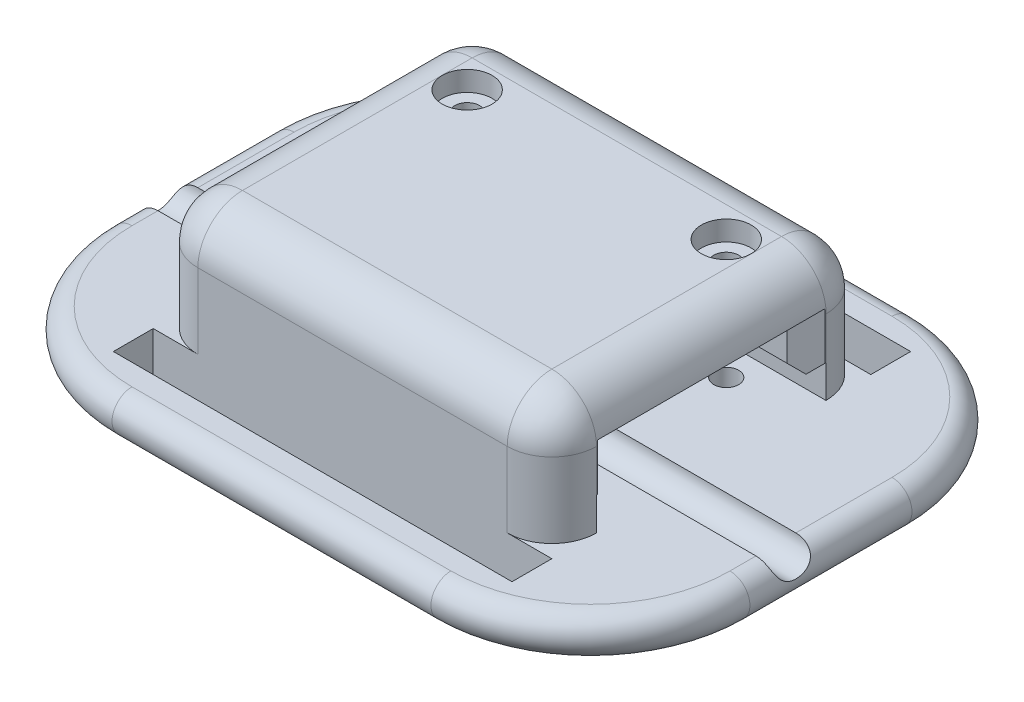
from build123d import *

# Parameters (mm, degrees)
SKETCH1_W               = 31.75
SKETCH1_H               = 25.4
BOSS_EXTRUDE1_DEPTH     = 12.7
SKETCH2_W               = 18.25625
SKETCH2_H               = 6.35
CUT_EXTRUDE3_DEPTH      = 39.058949894
SKETCH4_W               = 1.5875
SKETCH4_H               = 4.7625
BOSS_EXTRUDE2_DEPTH     = 31.75
CUT_EXTRUDE5_DEPTH      = 31.590858593
CUT_EXTRUDE5_DEPTH_BACK = 31.590858593
SKETCH5_R               = 0.9921875
CUT_EXTRUDE6_DEPTH      = 1.5875
SKETCH7_R               = 1.984375
CUT_EXTRUDE7_DEPTH      = 1.5875
SKETCH8_W               = 50.8
SKETCH8_H               = 38.305926372
SKETCH8_W_2             = 31.75
SKETCH8_H_2             = 25.4
BOSS_EXTRUDE3_DEPTH     = 3.175
SKETCH10_W              = 31.75
SKETCH10_H              = 3.175
CUT_EXTRUDE8_DEPTH      = 42.677098196
FILLET6_R               = 12.7
CHAMFER1_SIZE           = 1.016
CHAMFER2_SIZE           = 1.524
FILLET7_R               = 3.556
FILLET10_R              = 1.5875
SKETCH13_R              = 1.5875
CUT_EXTRUDE9_DEPTH      = 74.216005252


# Some blends are built 0.0001 mm under size
with BuildPart() as part:
    # Sketch1 → Boss-Extrude1 (new body)
    with BuildSketch(Plane(origin=(0, 0, 0), x_dir=(1, 0, 0), z_dir=(0, 1, 0))):
        with Locations((7.914574134, 4.007219009)):
            Rectangle(SKETCH1_W, SKETCH1_H)
    extrude(amount=BOSS_EXTRUDE1_DEPTH)

    # Sketch2 → Cut-Extrude3 (cut, through all)
    with BuildSketch(Plane(origin=(23.789574134, 0, 0), x_dir=(0, 0, -1), z_dir=(1, 0, 0))):
        with Locations((4.007219009, 6.35)):
            Rectangle(SKETCH2_W, SKETCH2_H)
    extrude(amount=-CUT_EXTRUDE3_DEPTH, mode=Mode.SUBTRACT)

    # Sketch4 → Boss-Extrude2 (add, through all)
    with BuildSketch(Plane(origin=(23.789574134, 0, 0), x_dir=(0, 0, -1), z_dir=(1, 0, 0))):
        with Locations((-4.327155991, 7.14375)):
            Rectangle(SKETCH4_W, SKETCH4_H)
        with Locations((12.341594009, 7.14375)):
            Rectangle(SKETCH4_W, SKETCH4_H)
    extrude(amount=-BOSS_EXTRUDE2_DEPTH)

    # Sketch5 → Cut-Extrude5 (cut, two sides: drawn at the far end of the back side and taken through both)
    with BuildSketch(Plane(origin=(0, 3.175, 0), x_dir=(1, 0, 0), z_dir=(0, 1, 0)).offset(-CUT_EXTRUDE5_DEPTH_BACK)):
        with Locations(Location((-2.404175866, 10.754094009, 0), (0, 0, 270))):
            Circle(SKETCH5_R)
        with Locations(Location((18.233324134, 10.754094009, 0), (0, 0, 126.869897646))):
            Circle(SKETCH5_R)
    extrude(amount=CUT_EXTRUDE5_DEPTH + CUT_EXTRUDE5_DEPTH_BACK, mode=Mode.SUBTRACT)

    # Sketch6 → Cut-Extrude6 (cut)
    with BuildSketch(Plane.XZ):
        Polygon((-0.022925866, -10.754094009), (-1.213550866, -8.691871016), (-3.594800866, -8.691871016), (-4.785425866, -10.754094009), (-3.594800866, -12.816317002), (-1.213550866, -12.816317002), align=None)
        Polygon((20.614574134, -10.754094009), (19.423949134, -8.691871016), (17.042699134, -8.691871016), (15.852074134, -10.754094009), (17.042699134, -12.816317002), (19.423949134, -12.816317002), align=None)
    extrude(amount=-CUT_EXTRUDE6_DEPTH, mode=Mode.SUBTRACT)

    # Sketch7 → Cut-Extrude7 (cut)
    with BuildSketch(Plane(origin=(0, 12.7, 0), x_dir=(1, 0, 0), z_dir=(0, 1, 0))):
        with Locations(Location((-2.404175866, 10.754094009, 0), (0, 0, 270))):
            Circle(SKETCH7_R)
        with Locations(Location((18.233324134, 10.754094009, 0), (0, 0, 270))):
            Circle(SKETCH7_R)
    extrude(amount=-CUT_EXTRUDE7_DEPTH, mode=Mode.SUBTRACT)

    # Sketch8 → Boss-Extrude3 (add)
    with BuildSketch(Plane.XZ):
        with Locations((7.914574134, -4.007219009)):
            Rectangle(SKETCH8_W, SKETCH8_H)
        with Locations((7.914574134, -4.007219009)):
            Rectangle(SKETCH8_W_2, SKETCH8_H_2, mode=Mode.SUBTRACT)
    extrude(amount=-BOSS_EXTRUDE3_DEPTH)

    # Sketch10 → Cut-Extrude8 (cut, through all)
    with BuildSketch(Plane(origin=(0, 3.175, 0), x_dir=(1, 0, 0), z_dir=(0, 1, 0))):
        with Locations((7.914574134, 18.294719009)):
            Rectangle(SKETCH10_W, SKETCH10_H)
        with Locations((7.914574134, -10.280280991)):
            Rectangle(SKETCH10_W, SKETCH10_H)
    extrude(amount=-CUT_EXTRUDE8_DEPTH, mode=Mode.SUBTRACT)

    # Fillet6
    fillet6_edges = [part.edges().sort_by_distance(p)[0] for p in [
        (-17.485425866, 1.5875, 15.145744177),
        (33.314574134, 1.5875, 15.145744177),
        (33.314574134, 1.5875, -23.160182195),
        (-17.485425866, 1.5875, -23.160182195),
    ]]
    fillet(fillet6_edges, radius=FILLET6_R)

    # Chamfer1
    # the kernel refuses this chamfer: 1.016 mm, written as the material it takes off along each edge
    with BuildSketch(Plane(origin=(-7.960425866, 4.7625, 0.920576075), x_dir=(-0.027495876610586435, 0.9996219169112968, 0), z_dir=(0, 0, 1)), Plane(origin=(-7.960425866, 4.7625, -13.135344009), x_dir=(-0.027495876610586435, 0.9996219169112968, 1.1185418764848949e-15), z_dir=(0, 0, 1))) as chamfer1_piece_1:
        Polygon((CHAMFER1_SIZE * 0.999621916911, -CHAMFER1_SIZE * 0.0274958766106), (-CHAMFER1_SIZE * 0.0274958766106, -CHAMFER1_SIZE * 0.999621916911), (0, 0), align=None)
    extrude(amount=4.200329916, mode=Mode.SUBTRACT)
    with BuildSketch(Plane(origin=(26.402404049, 4.7625, 3.533405991), x_dir=(0, 0.9996219169112968, -0.027495876610586435), z_dir=(-1, 0, 0))) as chamfer1_piece_2:
        Polygon((CHAMFER1_SIZE * 0.999621916911, -CHAMFER1_SIZE * 0.0274958766106), (-CHAMFER1_SIZE * 0.0274958766106, -CHAMFER1_SIZE * 0.999621916911), (0, 0), align=None)
    extrude(amount=36.975659832, mode=Mode.SUBTRACT)
    with BuildSketch(Plane(origin=(23.789574134, 4.7625, 0.920576075), x_dir=(0.027495876610587285, 0.9996219169112968, 0), z_dir=(0, 0, 1)), Plane(origin=(23.789574134, 4.7625, -13.135344009), x_dir=(0.027495876610587285, 0.9996219169112968, 1.1185418764848949e-15), z_dir=(0, 0, 1))) as chamfer1_piece_3:
        Polygon((CHAMFER1_SIZE * 0.999621916911, CHAMFER1_SIZE * 0.0274958766106), (-CHAMFER1_SIZE * 0.0274958766106, CHAMFER1_SIZE * 0.999621916911), (0, 0), align=None)
    extrude(amount=4.200329916, mode=Mode.SUBTRACT)
    with BuildSketch(Plane(origin=(-0.386658451, 4.7625, -11.547844009), x_dir=(0, -0.027495876610585605, -0.9996219169112968), z_dir=(-1, 0, 0)), Plane(origin=(26.402404049, 4.7625, -11.547844009), x_dir=(0, -0.027495876610585605, -0.9996219169112968), z_dir=(-1, 0, 0))) as chamfer1_piece_4:
        Polygon((CHAMFER1_SIZE * 0.999621916911, -CHAMFER1_SIZE * 0.0274958766106), (-CHAMFER1_SIZE * 0.0274958766106, -CHAMFER1_SIZE * 0.999621916911), (0, 0), align=None)
    extrude(amount=10.186597332, mode=Mode.SUBTRACT)
    with BuildSketch(Plane(origin=(20.250841549, 4.7625, -11.547844009), x_dir=(0, -0.027495876610585605, -0.9996219169112968), z_dir=(-1, 0, 0))) as chamfer1_piece_5:
        Polygon((CHAMFER1_SIZE * 0.999621916911, -CHAMFER1_SIZE * 0.0274958766106), (-CHAMFER1_SIZE * 0.0274958766106, -CHAMFER1_SIZE * 0.999621916911), (0, 0), align=None)
    extrude(amount=24.672534832, mode=Mode.SUBTRACT)

    # Chamfer2
    chamfer2_edges = [part.edges().sort_by_distance(p)[0] for p in [
        (-7.960425866, 7.65175, 3.533405991),
        (23.789574134, 7.65175, 3.533405991),
        (-7.960425866, 7.65175, -11.547844009),
        (23.789574134, 7.65175, -11.547844009),
    ]]
    chamfer(chamfer2_edges, length=CHAMFER2_SIZE)

    # Fillet7
    # the kernel refuses this fillet: 3.556 mm, written as the material it takes off along each edge
    with BuildSketch(Plane(origin=(20.233574134, 9.144, 5.136780991), x_dir=(0, 0, 1), z_dir=(1, 0, 0))) as fillet7_piece_1_section:
        Polygon((0, 0), (FILLET7_R * 1.02, 0), (FILLET7_R * 1.02, -FILLET7_R * 1.02), (0, -FILLET7_R * 1.02), align=None)
    fillet7_piece_1 = extrude(amount=FILLET7_R * 1.02, mode=Mode.PRIVATE)
    fillet7_piece_1 = fillet7_piece_1 - Plane(origin=(20.233574134, 9.144, 5.136780991), x_dir=(0, -0.7071067811865475, -0.7071067811865475), z_dir=(1, 0, 0)) * Sphere(FILLET7_R, mode=Mode.PRIVATE)
    add(fillet7_piece_1, mode=Mode.SUBTRACT)
    with BuildSketch(Plane(origin=(-4.404425866, 9.144, 5.136780991), x_dir=(0, 0, 1), z_dir=(-1, 0, 0))) as fillet7_piece_2_section:
        Polygon((0, 0), (FILLET7_R * 1.02, 0), (FILLET7_R * 1.02, FILLET7_R * 1.02), (0, FILLET7_R * 1.02), align=None)
    fillet7_piece_2 = extrude(amount=FILLET7_R * 1.02, mode=Mode.PRIVATE)
    fillet7_piece_2 = fillet7_piece_2 - Plane(origin=(-4.404425866, 9.144, 5.136780991), x_dir=(0, -0.7071067811865475, -0.7071067811865475), z_dir=(-1, 0, 0)) * Sphere(FILLET7_R, mode=Mode.PRIVATE)
    add(fillet7_piece_2, mode=Mode.SUBTRACT)
    with BuildSketch(Plane(origin=(20.233574134, 9.144, -13.151219009), x_dir=(1, 0, 0), z_dir=(0, 0, -1))) as fillet7_piece_3_section:
        Polygon((0, 0), (FILLET7_R * 1.02, 0), (FILLET7_R * 1.02, -FILLET7_R * 1.02), (0, -FILLET7_R * 1.02), align=None)
    fillet7_piece_3 = extrude(amount=FILLET7_R * 1.02, mode=Mode.PRIVATE)
    fillet7_piece_3 = fillet7_piece_3 - Plane(origin=(20.233574134, 9.144, -13.151219009), x_dir=(-0.7071067811865475, -0.7071067811865475, 0), z_dir=(0, 0, -1)) * Sphere(FILLET7_R, mode=Mode.PRIVATE)
    add(fillet7_piece_3, mode=Mode.SUBTRACT)
    with BuildSketch(Plane(origin=(-4.404425866, 9.144, -13.151219009), x_dir=(-1, 0, 0), z_dir=(0, 0, -1))) as fillet7_piece_4_section:
        Polygon((0, 0), (FILLET7_R * 1.02, 0), (FILLET7_R * 1.02, FILLET7_R * 1.02), (0, FILLET7_R * 1.02), align=None)
    fillet7_piece_4 = extrude(amount=FILLET7_R * 1.02, mode=Mode.PRIVATE)
    fillet7_piece_4 = fillet7_piece_4 - Plane(origin=(-4.404425866, 9.144, -13.151219009), x_dir=(0.7071067811865475, -0.7071067811865475, 0), z_dir=(0, 0, -1)) * Sphere(FILLET7_R, mode=Mode.PRIVATE)
    add(fillet7_piece_4, mode=Mode.SUBTRACT)
    with BuildSketch(Plane(origin=(20.233574134, 12.7, 8.692780991), x_dir=(0, -1, 0), z_dir=(-1, 0, 0))) as fillet7_piece_5:
        with BuildLine():
            CenterArc((FILLET7_R, -FILLET7_R), FILLET7_R, 90, 90)
            Line((0, -FILLET7_R), (0, 0))
            Line((0, 0), (FILLET7_R, 0))
        make_face()
    extrude(amount=24.638, mode=Mode.SUBTRACT)
    with BuildSketch(Plane(origin=(23.789574134, 3.175, 8.692780991), x_dir=(-1, 0, 0), z_dir=(0, 1, 0)), Plane(origin=(-7.960425866, 3.175, -16.707219009), x_dir=(1, 0, 0), z_dir=(0, 1, 0))) as fillet7_piece_6:
        with BuildLine():
            CenterArc((FILLET7_R, -FILLET7_R), FILLET7_R, 90, 90)
            Line((0, -FILLET7_R), (0, 0))
            Line((0, 0), (FILLET7_R, 0))
        make_face()
    extrude(amount=5.969, mode=Mode.SUBTRACT)
    with BuildSketch(Plane(origin=(23.789574134, 12.7, -13.151219009), x_dir=(-1, 0, 0), z_dir=(0, 0, 1)), Plane(origin=(-7.960425866, 12.7, 5.136780991), x_dir=(1, 0, 0), z_dir=(0, 0, -1))) as fillet7_piece_7:
        with BuildLine():
            CenterArc((FILLET7_R, FILLET7_R), FILLET7_R, 180, 90)
            Line((0, FILLET7_R), (0, 0))
            Line((0, 0), (FILLET7_R, 0))
        make_face()
    extrude(amount=18.288, mode=Mode.SUBTRACT)
    with BuildSketch(Plane(origin=(23.789574134, 3.175, -16.707219009), x_dir=(-1, 0, 0), z_dir=(0, 1, 0)), Plane(origin=(-7.960425866, 3.175, 8.692780991), x_dir=(1, 0, 0), z_dir=(0, 1, 0))) as fillet7_piece_8:
        with BuildLine():
            CenterArc((FILLET7_R, FILLET7_R), FILLET7_R, 180, 90)
            Line((0, FILLET7_R), (0, 0))
            Line((0, 0), (FILLET7_R, 0))
        make_face()
    extrude(amount=5.969, mode=Mode.SUBTRACT)
    with BuildSketch(Plane(origin=(-4.404425866, 12.7, -16.707219009), x_dir=(0, 0, 1), z_dir=(1, 0, 0))) as fillet7_piece_9:
        with BuildLine():
            CenterArc((FILLET7_R, FILLET7_R), FILLET7_R, 180, 90)
            Line((0, FILLET7_R), (0, 0))
            Line((0, 0), (FILLET7_R, 0))
        make_face()
    extrude(amount=24.638, mode=Mode.SUBTRACT)

    # Fillet10
    fillet10_edges = [part.edges().sort_by_distance(p)[0] for p in [
        (7.914574134, 3.175, 15.145744177),
        (7.914574134, 0, 15.145744177),
        (-17.485425866, 0, -4.007219009),
        (7.914574134, 0, -23.160182195),
        (33.314574134, 0, -4.007219009),
        (29.594830255, 0, 11.426000298),
        (29.594830255, 0, -19.440438316),
        (-13.765681988, 0, -19.440438316),
        (-13.765681988, 0, 11.426000298),
        (-17.485425866, 3.175, -4.007219009),
        (33.314574134, 3.175, -4.007219009),
        (7.914574134, 3.175, -23.160182195),
    ]]
    fillet(fillet10_edges, radius=FILLET10_R - 0.0001)  # a hair under: the kernel refuses the full size

    # Sketch13 → Cut-Extrude9 (cut, through all)
    with BuildSketch(Plane(origin=(50.8, 0, 0), x_dir=(0, 0, -1), z_dir=(1, 0, 0))):
        with Locations((1.213219009, 3.175)):
            Circle(SKETCH13_R)
    extrude(amount=-CUT_EXTRUDE9_DEPTH, mode=Mode.SUBTRACT)


solid = part.part
